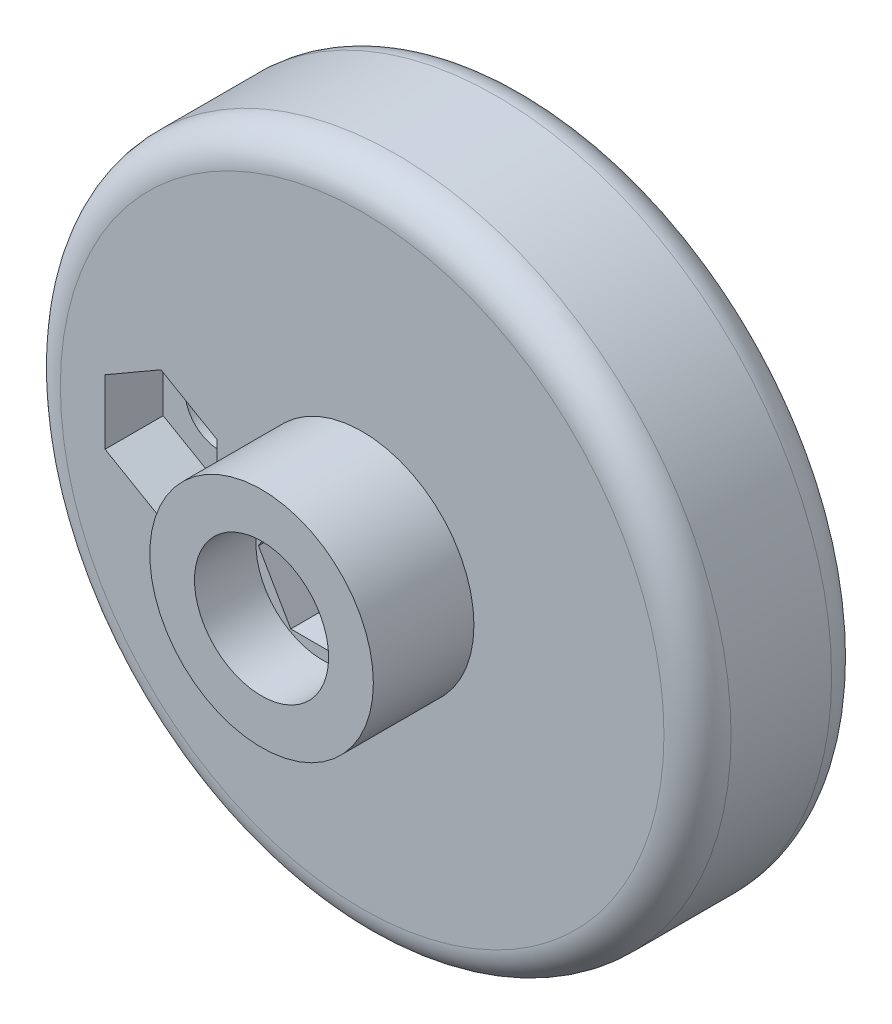
from build123d import *

# Parameters (mm, degrees)
SKETCH1_R           = 30
BOSS_EXTRUDE1_DEPTH = 15
SKETCH2_R           = 10
BOSS_EXTRUDE2_DEPTH = 9
SKETCH3_R           = 3.25
CUT_EXTRUDE1_DEPTH  = 49.744230428
FILLET1_R           = 3
SKETCH4_R           = 6
CUT_EXTRUDE2_DEPTH  = 4
FILLET2_R           = 1
SKETCH8_R           = 3.05
CUT_EXTRUDE3_DEPTH  = 46.000000067
CUT_EXTRUDE4_DEPTH  = 5.2
CUT_EXTRUDE5_START  = -5.5
SKETCH9_R           = 6
CUT_EXTRUDE5_DEPTH  = 5.5
CUT_EXTRUDE6_DEPTH  = 5.5


with BuildPart() as part:
    # Sketch1 → Boss-Extrude1 (new body)
    with BuildSketch(Plane.XY):
        Circle(SKETCH1_R)
    extrude(amount=BOSS_EXTRUDE1_DEPTH)

    # Sketch2 → Boss-Extrude2 (add)
    with BuildSketch(Plane.XY.offset(15)):
        Circle(SKETCH2_R)
    extrude(amount=BOSS_EXTRUDE2_DEPTH)

    # Sketch3 → Cut-Extrude1 (cut, through all)
    with BuildSketch(Plane.XY.offset(24)):
        Circle(SKETCH3_R)
    extrude(amount=-CUT_EXTRUDE1_DEPTH, mode=Mode.SUBTRACT)

    # Fillet1
    fillet1_edges = [part.edges().sort_by_distance(p)[0] for p in [
        (-30, 0, 0),
        (-30, 0, 15),
    ]]
    fillet(fillet1_edges, radius=FILLET1_R)

    # Sketch4 → Cut-Extrude2 (cut)
    with BuildSketch(Plane(origin=(0, 0, 0), x_dir=(-1, 0, 0), z_dir=(0, 0, -1))):
        Circle(SKETCH4_R)
    extrude(amount=-CUT_EXTRUDE2_DEPTH, mode=Mode.SUBTRACT)

    # Fillet2
    fillet2_edges = [part.edges().sort_by_distance(p)[0] for p in [
        (6, 0, 0),
    ]]
    fillet(fillet2_edges, radius=FILLET2_R)

    # Sketch8 → Cut-Extrude3 (cut, through all)
    with BuildSketch(Plane.XY.offset(15)):
        with Locations((-18, 0)):
            Circle(SKETCH8_R)
    extrude(amount=-CUT_EXTRUDE3_DEPTH, mode=Mode.SUBTRACT)

    # Sketch7 → Cut-Extrude4 (cut)
    with BuildSketch(Plane.XY.offset(15)):
        Polygon((-23, 2.886751346), (-23, -2.886751346), (-18, -5.773502692), (-13, -2.886751346), (-13, 2.886751346), (-18, 5.773502692), align=None)
    extrude(amount=-CUT_EXTRUDE4_DEPTH, mode=Mode.SUBTRACT)

    # Sketch9 → Cut-Extrude5 (cut)
    with BuildSketch(Plane.XY.offset(24).offset(CUT_EXTRUDE5_START)):
        Circle(SKETCH9_R)
    extrude(amount=CUT_EXTRUDE5_DEPTH, mode=Mode.SUBTRACT)

    # Sketch10 → Cut-Extrude6 (cut)
    with BuildSketch(Plane.XY.offset(18.5)):
        Polygon((5.773502692, 0), (2.886751346, 5), (-2.886751346, 5), (-5.773502692, 0), (-2.886751346, -5), (2.886751346, -5), align=None)
    extrude(amount=-CUT_EXTRUDE6_DEPTH, mode=Mode.SUBTRACT)


solid = part.part
